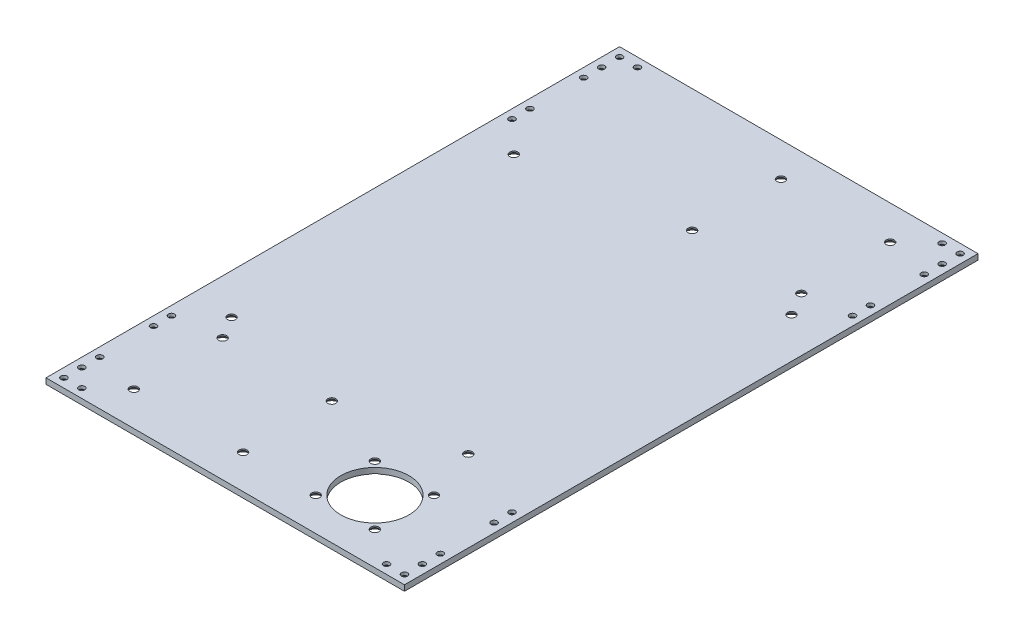
from build123d import *

# Parameters (mm, degrees)
SKETCH1_W                                       = 200
SKETCH1_H                                       = 320
BOSS_EXTRUDE1_DEPTH                             = 3.175
CSK_FOR_M3_FLAT_HEAD_MACHINE_SCREW1_D           = 3.4
CSK_FOR_M3_FLAT_HEAD_MACHINE_SCREW1_CSINK_D     = 6.3
CSK_FOR_M3_FLAT_HEAD_MACHINE_SCREW1_CSINK_ANGLE = 90
MIRROR2_COPY_1_D                                = 3.4
MIRROR2_COPY_1_CSINK_D                          = 6.3
MIRROR2_COPY_1_CSINK_ANGLE                      = 90
MIRROR2_COPY_2_D                                = 3.4
MIRROR2_COPY_2_CSINK_D                          = 6.3
MIRROR2_COPY_2_CSINK_ANGLE                      = 90
CSK_FOR_M4_FLAT_HEAD_MACHINE_SCREW1_AT_2_COUNT  = 2
CSK_FOR_M4_FLAT_HEAD_MACHINE_SCREW1_AT_2_PITCH  = 64.709214954
CSK_FOR_M4_FLAT_HEAD_MACHINE_SCREW1_AT_3_COUNT  = 2
CSK_FOR_M4_FLAT_HEAD_MACHINE_SCREW1_AT_3_PITCH  = 44.433123905
CSK_FOR_M4_FLAT_HEAD_MACHINE_SCREW1_AT_4_COUNT  = 2
CSK_FOR_M4_FLAT_HEAD_MACHINE_SCREW1_AT_4_PITCH  = 75.973301231
CSK_FOR_M4_FLAT_HEAD_MACHINE_SCREW1_AT_5_COUNT  = 2
CSK_FOR_M4_FLAT_HEAD_MACHINE_SCREW1_AT_5_PITCH  = 78.545162168
CSK_FOR_M4_FLAT_HEAD_MACHINE_SCREW1_AT_6_COUNT  = 2
CSK_FOR_M4_FLAT_HEAD_MACHINE_SCREW1_AT_6_PITCH  = 60.96
CSK_FOR_M4_FLAT_HEAD_MACHINE_SCREW1_AT_7_COUNT  = 2
CSK_FOR_M4_FLAT_HEAD_MACHINE_SCREW1_AT_7_PITCH  = 49.53
CSK_FOR_M4_FLAT_HEAD_MACHINE_SCREW1_AT_8_COUNT  = 2
CSK_FOR_M4_FLAT_HEAD_MACHINE_SCREW1_AT_8_PITCH  = 89.358393562
CSK_FOR_M4_FLAT_HEAD_MACHINE_SCREW1_AT_9_COUNT  = 2
CSK_FOR_M4_FLAT_HEAD_MACHINE_SCREW1_AT_9_PITCH  = 245.539452023
CSK_FOR_M4_FLAT_HEAD_MACHINE_SCREW1_AT_1_COUNT  = 2
CSK_FOR_M4_FLAT_HEAD_MACHINE_SCREW1_AT_1_PITCH  = 233.172012257
CSK_FOR_M4_FLAT_HEAD_MACHINE_SCREW1_2_COUNT     = 2
CSK_FOR_M4_FLAT_HEAD_MACHINE_SCREW1_2_PITCH     = 183.831254144
CSK_FOR_M4_FLAT_HEAD_MACHINE_SCREW1_3_COUNT     = 2
CSK_FOR_M4_FLAT_HEAD_MACHINE_SCREW1_3_PITCH     = 199.284633627
CSK_FOR_M4_FLAT_HEAD_MACHINE_SCREW1_4_COUNT     = 2
CSK_FOR_M4_FLAT_HEAD_MACHINE_SCREW1_4_PITCH     = 64.860029294
CSK_FOR_M4_FLAT_HEAD_MACHINE_SCREW1_5_COUNT     = 2
CSK_FOR_M4_FLAT_HEAD_MACHINE_SCREW1_5_PITCH     = 190.701291553
CSK_FOR_M4_FLAT_HEAD_MACHINE_SCREW1_6_COUNT     = 2
CSK_FOR_M4_FLAT_HEAD_MACHINE_SCREW1_6_PITCH     = 183.209354019
CSK_FOR_M4_FLAT_HEAD_MACHINE_SCREW1_7_COUNT     = 2
CSK_FOR_M4_FLAT_HEAD_MACHINE_SCREW1_7_PITCH     = 69.556924889
SKETCH8_R                                       = 19
CUT_EXTRUDE1_DEPTH                              = 189.706334353


with BuildPart() as part:
    # Sketch1 → Boss-Extrude1 (new body)
    with BuildSketch(Plane(origin=(0, 0, 0), x_dir=(1, 0, 0), z_dir=(0, 1, 0))):
        Rectangle(SKETCH1_W, SKETCH1_H)
    extrude(amount=BOSS_EXTRUDE1_DEPTH)

    # CSK for M3 Flat Head Machine Screw1 (through all)
    with Locations(Plane.XZ):
        with Locations((-95, 155), (-85, 155), (-95, 145), (-95, 135), (-95, 105), (-95, 95)):
            csk_for_m3_flat_head_machine_screw1 = CounterSinkHole(CSK_FOR_M3_FLAT_HEAD_MACHINE_SCREW1_D / 2, CSK_FOR_M3_FLAT_HEAD_MACHINE_SCREW1_CSINK_D / 2, counter_sink_angle=CSK_FOR_M3_FLAT_HEAD_MACHINE_SCREW1_CSINK_ANGLE)

    # Mirror1: CSK for M3 Flat Head Machine Screw1 across plane
    add(csk_for_m3_flat_head_machine_screw1.mirror(Plane(origin=(0, 0, 0), x_dir=(0, 0, 1), z_dir=(1, 0, 0))), mode=Mode.SUBTRACT)

    # Mirror2 copy 1 (through all)
    with Locations(Plane(origin=(0, 0, 0), x_dir=(-1, 0, 0), z_dir=(0, -1, 0))):
        with Locations((-95, 155), (-85, 155), (-95, 145), (-95, 135), (-95, 105), (-95, 95)):
            CounterSinkHole(MIRROR2_COPY_1_D / 2, MIRROR2_COPY_1_CSINK_D / 2, counter_sink_angle=MIRROR2_COPY_1_CSINK_ANGLE)

    # Mirror2 copy 2 (through all)
    with Locations(Plane.XZ):
        with Locations((-95, -155), (-85, -155), (-95, -145), (-95, -135), (-95, -105), (-95, -95)):
            CounterSinkHole(MIRROR2_COPY_2_D / 2, MIRROR2_COPY_2_CSINK_D / 2, counter_sink_angle=MIRROR2_COPY_2_CSINK_ANGLE)

    # Sketch6 → CSK for M4 Flat Head Machine Screw1 (revolve, cut)
    with BuildSketch(Plane(origin=(-9.04, 0, 91.47), x_dir=(0, 0, -1), z_dir=(1, 0, 0))):
        Polygon((0, 0), (0, 3.175), (2.25, 3.175), (2.25, 2.45), (4.7, 0), align=None)
    csk_for_m4_flat_head_machine_screw1 = revolve(axis=Axis((-9.04, -6.35, 91.47), (0, 1, 0)), mode=Mode.SUBTRACT)

    # CSK for M4 Flat Head Machine Screw1 at 2: CSK for M4 Flat Head Machine Screw1 ×2
    with Locations(*[Vector(0.6342218805929383, 0, 0.7731510888417327) * (i * CSK_FOR_M4_FLAT_HEAD_MACHINE_SCREW1_AT_2_PITCH) for i in range(1, CSK_FOR_M4_FLAT_HEAD_MACHINE_SCREW1_AT_2_COUNT)]):
        add(csk_for_m4_flat_head_machine_screw1, mode=Mode.SUBTRACT)

    # CSK for M4 Flat Head Machine Screw1 at 3: CSK for M4 Flat Head Machine Screw1 ×2
    with Locations(*[Vector(0.9236352611015892, 0, 0.38327262418518643) * (i * CSK_FOR_M4_FLAT_HEAD_MACHINE_SCREW1_AT_3_PITCH) for i in range(1, CSK_FOR_M4_FLAT_HEAD_MACHINE_SCREW1_AT_3_COUNT)]):
        add(csk_for_m4_flat_head_machine_screw1, mode=Mode.SUBTRACT)

    # CSK for M4 Flat Head Machine Screw1 at 4: CSK for M4 Flat Head Machine Screw1 ×2
    with Locations(*[Vector(0.9745528863418678, 0, 0.22415769387360895) * (i * CSK_FOR_M4_FLAT_HEAD_MACHINE_SCREW1_AT_4_PITCH) for i in range(1, CSK_FOR_M4_FLAT_HEAD_MACHINE_SCREW1_AT_4_COUNT)]):
        add(csk_for_m4_flat_head_machine_screw1, mode=Mode.SUBTRACT)

    # CSK for M4 Flat Head Machine Screw1 at 5: CSK for M4 Flat Head Machine Screw1 ×2
    with Locations(*[Vector(-0.7761140001162656, 0, 0.6305926250944657) * (i * CSK_FOR_M4_FLAT_HEAD_MACHINE_SCREW1_AT_5_PITCH) for i in range(1, CSK_FOR_M4_FLAT_HEAD_MACHINE_SCREW1_AT_5_COUNT)]):
        add(csk_for_m4_flat_head_machine_screw1, mode=Mode.SUBTRACT)

    # CSK for M4 Flat Head Machine Screw1 at 6: CSK for M4 Flat Head Machine Screw1 ×2
    with Locations(*[(-i * CSK_FOR_M4_FLAT_HEAD_MACHINE_SCREW1_AT_6_PITCH, 0, 0) for i in range(1, CSK_FOR_M4_FLAT_HEAD_MACHINE_SCREW1_AT_6_COUNT)]):
        add(csk_for_m4_flat_head_machine_screw1, mode=Mode.SUBTRACT)

    # CSK for M4 Flat Head Machine Screw1 at 7: CSK for M4 Flat Head Machine Screw1 ×2
    with Locations(*[(0, 0, i * CSK_FOR_M4_FLAT_HEAD_MACHINE_SCREW1_AT_7_PITCH) for i in range(1, CSK_FOR_M4_FLAT_HEAD_MACHINE_SCREW1_AT_7_COUNT)]):
        add(csk_for_m4_flat_head_machine_screw1, mode=Mode.SUBTRACT)

    # CSK for M4 Flat Head Machine Screw1 at 8: CSK for M4 Flat Head Machine Screw1 ×2
    with Locations(*[Vector(0.8285735346007722, 0, 0.5598802530534392) * (i * CSK_FOR_M4_FLAT_HEAD_MACHINE_SCREW1_AT_8_PITCH) for i in range(1, CSK_FOR_M4_FLAT_HEAD_MACHINE_SCREW1_AT_8_COUNT)]):
        add(csk_for_m4_flat_head_machine_screw1, mode=Mode.SUBTRACT)

    # CSK for M4 Flat Head Machine Screw1 at 9: CSK for M4 Flat Head Machine Screw1 ×2
    with Locations(*[Vector(0.32190346336863085, 0, -0.946772496575223) * (i * CSK_FOR_M4_FLAT_HEAD_MACHINE_SCREW1_AT_9_PITCH) for i in range(1, CSK_FOR_M4_FLAT_HEAD_MACHINE_SCREW1_AT_9_COUNT)]):
        add(csk_for_m4_flat_head_machine_screw1, mode=Mode.SUBTRACT)

    # CSK for M4 Flat Head Machine Screw1 at 1: CSK for M4 Flat Head Machine Screw1 ×2
    with Locations(*[Vector(0.07753932311597003, 0, -0.9969892945115897) * (i * CSK_FOR_M4_FLAT_HEAD_MACHINE_SCREW1_AT_1_PITCH) for i in range(1, CSK_FOR_M4_FLAT_HEAD_MACHINE_SCREW1_AT_1_COUNT)]):
        add(csk_for_m4_flat_head_machine_screw1, mode=Mode.SUBTRACT)

    # CSK for M4 Flat Head Machine Screw1  2: CSK for M4 Flat Head Machine Screw1 ×2
    with Locations(*[Vector(0.09835106703824785, 0, -0.9951517811934208) * (i * CSK_FOR_M4_FLAT_HEAD_MACHINE_SCREW1_2_PITCH) for i in range(1, CSK_FOR_M4_FLAT_HEAD_MACHINE_SCREW1_2_COUNT)]):
        add(csk_for_m4_flat_head_machine_screw1, mode=Mode.SUBTRACT)

    # CSK for M4 Flat Head Machine Screw1  3: CSK for M4 Flat Head Machine Screw1 ×2
    with Locations(*[Vector(0.3966186381825461, 0, -0.9179834725343494) * (i * CSK_FOR_M4_FLAT_HEAD_MACHINE_SCREW1_3_PITCH) for i in range(1, CSK_FOR_M4_FLAT_HEAD_MACHINE_SCREW1_3_COUNT)]):
        add(csk_for_m4_flat_head_machine_screw1, mode=Mode.SUBTRACT)

    # CSK for M4 Flat Head Machine Screw1  4: CSK for M4 Flat Head Machine Screw1 ×2
    with Locations(*[Vector(0.981343990944332, 0, -0.19226016601847318) * (i * CSK_FOR_M4_FLAT_HEAD_MACHINE_SCREW1_4_PITCH) for i in range(1, CSK_FOR_M4_FLAT_HEAD_MACHINE_SCREW1_4_COUNT)]):
        add(csk_for_m4_flat_head_machine_screw1, mode=Mode.SUBTRACT)

    # CSK for M4 Flat Head Machine Screw1  5: CSK for M4 Flat Head Machine Screw1 ×2
    with Locations(*[Vector(0.4536413953753217, 0, -0.8911843156171069) * (i * CSK_FOR_M4_FLAT_HEAD_MACHINE_SCREW1_5_PITCH) for i in range(1, CSK_FOR_M4_FLAT_HEAD_MACHINE_SCREW1_5_COUNT)]):
        add(csk_for_m4_flat_head_machine_screw1, mode=Mode.SUBTRACT)

    # CSK for M4 Flat Head Machine Screw1  6: CSK for M4 Flat Head Machine Screw1 ×2
    with Locations(*[Vector(-0.3735071299523483, 0, -0.927627308715499) * (i * CSK_FOR_M4_FLAT_HEAD_MACHINE_SCREW1_6_PITCH) for i in range(1, CSK_FOR_M4_FLAT_HEAD_MACHINE_SCREW1_6_COUNT)]):
        add(csk_for_m4_flat_head_machine_screw1, mode=Mode.SUBTRACT)

    # CSK for M4 Flat Head Machine Screw1  7: CSK for M4 Flat Head Machine Screw1 ×2
    with Locations(*[Vector(-0.9837985234295586, 0, -0.17927762073895362) * (i * CSK_FOR_M4_FLAT_HEAD_MACHINE_SCREW1_7_PITCH) for i in range(1, CSK_FOR_M4_FLAT_HEAD_MACHINE_SCREW1_7_COUNT)]):
        add(csk_for_m4_flat_head_machine_screw1, mode=Mode.SUBTRACT)

    # Sketch8 → Cut-Extrude1 (cut, through all)
    with BuildSketch(Plane(origin=(0, 3.175, 0), x_dir=(1, 0, 0), z_dir=(0, 1, 0))):
        with Locations((48.5, -125)):
            Circle(SKETCH8_R)
    extrude(amount=-CUT_EXTRUDE1_DEPTH, mode=Mode.SUBTRACT)


solid = part.part
